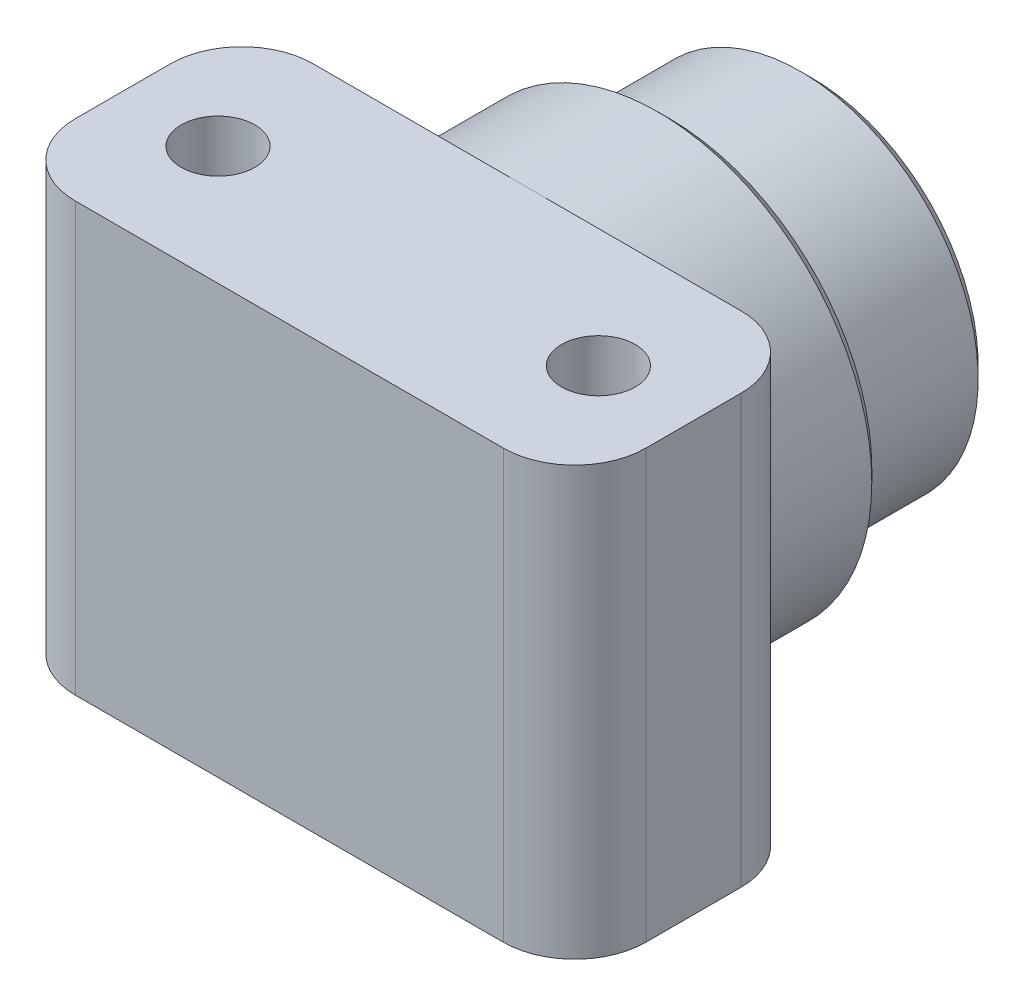
from build123d import *

# Parameters (mm, degrees)
SKETCH_1_W          = 24
SKETCH_1_H          = 18
EXTRUDE_1_DEPTH     = 10
SKETCH_2_R          = 9
EXTRUDE_2_DEPTH     = 6
SKETCH_4_R          = 1.55
CUT_EXTRUDE_2_DEPTH = 37.013519789
SKETCH1_R           = 7.475
BOSS_EXTRUDE1_DEPTH = 6
CHAMFER1_SIZE       = 0.5
FILLET1_R           = 3


with BuildPart() as part:
    # 草图1 → 凸台-拉伸1 (new body)
    with BuildSketch(Plane.XY):
        Rectangle(SKETCH_1_W, SKETCH_1_H)
    extrude(amount=EXTRUDE_1_DEPTH)

    # 草图2 → 凸台-拉伸2 (add)
    with BuildSketch(Plane.XY):
        Circle(SKETCH_2_R)
    extrude(amount=-EXTRUDE_2_DEPTH)

    # 草图4 → 切除-拉伸2 (cut)
    with BuildSketch(Plane(origin=(0, 9, 0), x_dir=(1, 0, 0), z_dir=(0, 1, 0))):
        with Locations(Location((-8, -5, 0), (0, 0, 270))):
            Circle(SKETCH_4_R)
        with Locations(Location((8, -5, 0), (0, 0, 270))):
            Circle(SKETCH_4_R)
    extrude(amount=-CUT_EXTRUDE_2_DEPTH, mode=Mode.SUBTRACT)

    # Sketch1 → Boss-Extrude1 (add)
    with BuildSketch(Plane(origin=(0, 0, -6), x_dir=(-1, 0, 0), z_dir=(0, 0, -1))):
        Circle(SKETCH1_R)
    extrude(amount=BOSS_EXTRUDE1_DEPTH)

    # Chamfer1
    chamfer1_edges = [part.edges().sort_by_distance(p)[0] for p in [
        (-9, 0, -6),
        (7.475, 0, -12),
    ]]
    chamfer(chamfer1_edges, length=CHAMFER1_SIZE)

    # Fillet1
    fillet1_edges = [part.edges().sort_by_distance(p)[0] for p in [
        (-12, 0, 10),
        (12, 0, 10),
        (-12, 0, 0),
        (12, 0, 0),
    ]]
    fillet(fillet1_edges, radius=FILLET1_R - 0.0001)  # a hair under: the kernel refuses the full size


solid = part.part
